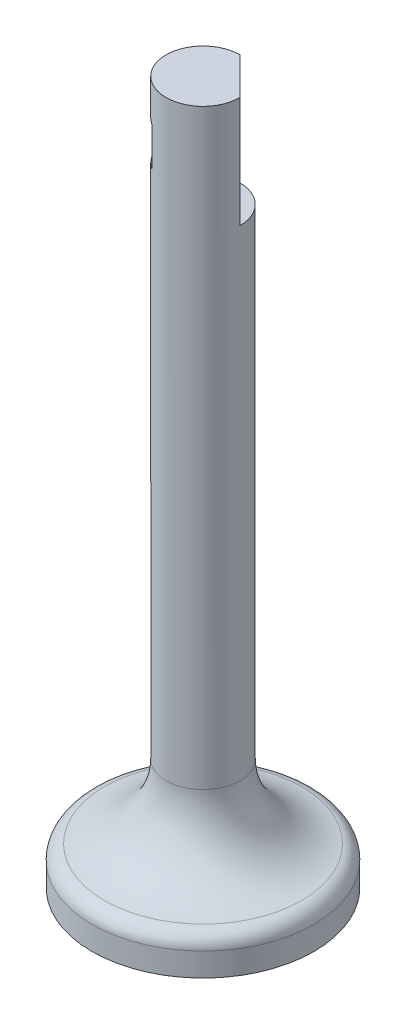
from build123d import *

# Parameters (mm, degrees)
SKETCH1_R           = 15
BOSS_EXTRUDE1_DEPTH = 5
SKETCH2_R           = 5
BOSS_EXTRUDE2_DEPTH = 90
CUT_EXTRUDE1_START  = -15
CUT_EXTRUDE1_DEPTH  = 15
SKETCH4_W           = 2
SKETCH4_H           = 5.2
CUT_EXTRUDE2_DEPTH  = 99.17076958
FILLET1_R           = 10
FILLET2_R           = 2
CUT_EXTRUDE3_DEPTH  = 1
SKETCH6_R           = 13.5
SKETCH6_R_2         = 11.5
CUT_EXTRUDE4_DEPTH  = 1


with BuildPart() as part:
    # Sketch1 → Boss-Extrude1 (new body)
    with BuildSketch(Plane(origin=(0, 0, 0), x_dir=(1, 0, 0), z_dir=(0, 1, 0))):
        with Locations(Location((0, 0, 0), (0, 0, 270))):
            Circle(SKETCH1_R)
    extrude(amount=BOSS_EXTRUDE1_DEPTH)

    # Sketch2 → Boss-Extrude2 (add)
    with BuildSketch(Plane(origin=(0, 5, 0), x_dir=(1, 0, 0), z_dir=(0, 1, 0))):
        with Locations(Location((0, 0, 0), (0, 0, 90))):
            Circle(SKETCH2_R)
    extrude(amount=BOSS_EXTRUDE2_DEPTH)

    # Sketch3 → Cut-Extrude1 (cut)
    with BuildSketch(Plane(origin=(0, 95, 0), x_dir=(1, 0, 0), z_dir=(0, 1, 0)).offset(CUT_EXTRUDE1_START)):
        with BuildLine():
            Line((0, 5), (5, 0))
            ThreePointArc((5, 0), (3.535533906, 3.535533906), (0, 5))
        make_face()
    extrude(amount=CUT_EXTRUDE1_DEPTH, mode=Mode.SUBTRACT)

    # Sketch4 → Cut-Extrude2 (cut, through all)
    with BuildSketch(Plane(origin=(2.5, 0, -2.5), x_dir=(-0.7071067811865475, 0, -0.7071067811865477), z_dir=(0.7071067811865477, 0, -0.7071067811865475))):
        with Locations((0, 87.5)):
            Rectangle(SKETCH4_W, SKETCH4_H)
    extrude(amount=-CUT_EXTRUDE2_DEPTH, mode=Mode.SUBTRACT)

    # Fillet1
    fillet1_edges = [part.edges().sort_by_distance(p)[0] for p in [
        (0, 5, 5),
    ]]
    fillet(fillet1_edges, radius=FILLET1_R - 0.0001)  # a hair under: the kernel refuses the full size

    # Fillet2
    fillet2_edges = [part.edges().sort_by_distance(p)[0] for p in [
        (0, 5, -15),
    ]]
    fillet(fillet2_edges, radius=FILLET2_R)

    # Sketch5 → Cut-Extrude3 (cut)
    with BuildSketch(Plane.XZ):
        with BuildLine():
            Line((-0.690387564, 10.623320935), (9.77235282, 0.16058055))
            Line((9.77235282, 0.16058055), (7.687016282, -1.924755988))
            Line((7.687016282, -1.924755988), (-2.195796218, 3.006133435))
            add(Edge.make_bspline(
                [(-2.195796218, 3.006133435), (-2.307029511, 3.062113904), (-2.52269645, 3.170652781), (-2.833890677, 3.329506222), (-3.122930247, 3.477577181), (-3.391022331, 3.612480856), (-3.636978399, 3.737620248), (-3.85910859, 3.856159494), (-4.059958905, 3.960316417), (-4.186011343, 4.026707574), (-4.245075064, 4.057816127)],
                knots=[0, 0, 0, 0, 1.297460102, 2.515607, 3.640415016, 4.681187102, 5.642653462, 6.515599393, 7.304462283, 8, 8, 8, 8], degree=3))
            add(Edge.make_bspline(
                [(-4.245075064, 4.057816127), (-4.210973718, 3.991734504), (-4.138662994, 3.851610709), (-4.025441526, 3.629760807), (-3.897989309, 3.38652834), (-3.762956902, 3.118983989), (-3.620144132, 2.827316511), (-3.462218864, 2.515142559), (-3.297896109, 2.177641474), (-3.18347293, 1.945388515), (-3.124281795, 1.825244012)],
                knots=[0, 0, 0, 0, 0.714390188, 1.514839662, 2.392796159, 3.352429004, 4.393822708, 5.512665897, 6.71330155, 8, 8, 8, 8], degree=3))
            Line((-3.124281795, 1.825244012), (1.650357628, -7.961414642))
            Line((1.650357628, -7.961414642), (-0.212623141, -9.824395412))
            Line((-0.212623141, -9.824395412), (-10.675363526, 0.638344973))
            Line((-10.675363526, 0.638344973), (-9.34122891, 1.972479588))
            Line((-9.34122891, 1.972479588), (-0.585219295, -6.783530027))
            Line((-0.585219295, -6.783530027), (-6.300363526, 5.013344973))
            Line((-6.300363526, 5.013344973), (-5.050363526, 6.263344973))
            Line((-5.050363526, 6.263344973), (6.88172782, 0.382936319))
            Line((6.88172782, 0.382936319), (-2.02452218, 9.289186319))
            Line((-2.02452218, 9.289186319), (-0.690387564, 10.623320935))
        make_face()
    extrude(amount=-CUT_EXTRUDE3_DEPTH, mode=Mode.SUBTRACT)

    # Sketch6 → Cut-Extrude4 (cut)
    with BuildSketch(Plane.XZ):
        with Locations(Location((0, 0, 0), (0, 0, 270))):
            Circle(SKETCH6_R)
        with Locations(Location((0, 0, 0), (0, 0, 270))):
            Circle(SKETCH6_R_2, mode=Mode.SUBTRACT)
    extrude(amount=-CUT_EXTRUDE4_DEPTH, mode=Mode.SUBTRACT)


solid = part.part
